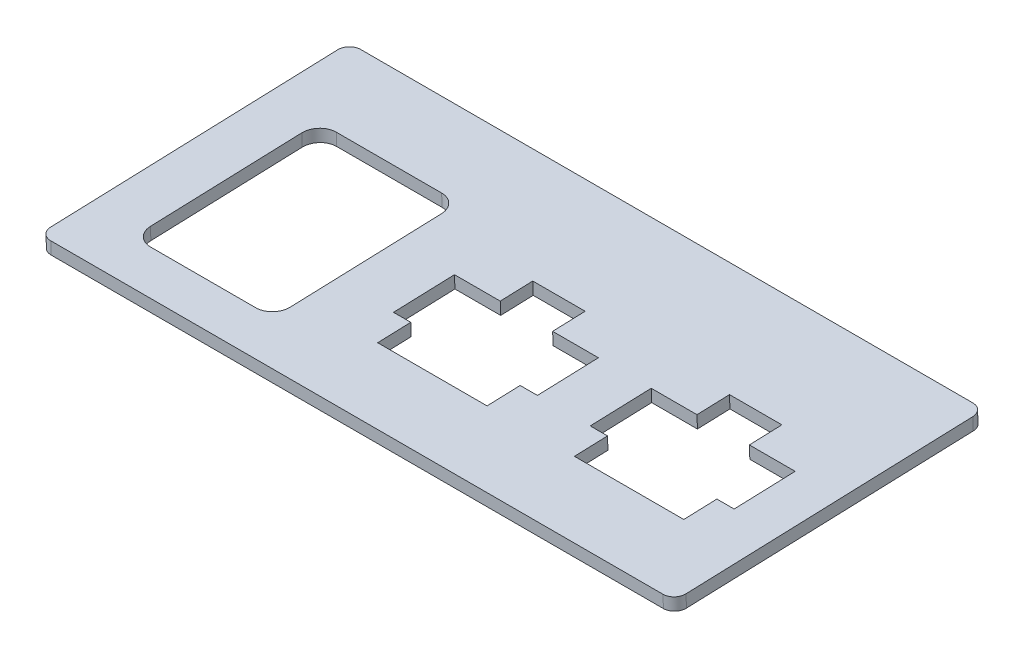
from build123d import *

# Parameters (mm, degrees)
SKETCH1_W           = 110.35
SKETCH1_H           = 53.851961072
BOSS_EXTRUDE1_DEPTH = 2.2
CUT_EXTRUDE1_REACH  = 76.303
FILLET1_R           = 2


with BuildPart() as part:
    # Sketch1 → Boss-Extrude1 (new body)
    with BuildSketch(Plane(origin=(0, -71.98718802, -2.513847999), x_dir=(1, 0, 0), z_dir=(0, 0.9993908270190958, 0.03489949670250105))):
        with Locations((0, 22.714385256)):
            Rectangle(SKETCH1_W, SKETCH1_H)
    extrude(amount=BOSS_EXTRUDE1_DEPTH)

    # Sketch2 → Cut-Extrude1 (cut, up to next)
    with BuildSketch(Plane(origin=(0, -71.98718802, -2.513847999), x_dir=(1, 0, 0), z_dir=(0, -0.9993908270190958, -0.03489949670250106)), mode=Mode.PRIVATE) as cut_extrude1_sk1:
        Polygon((-4.05, -24.762401314), (-4.05, -30.412401314), (5.05, -30.412401314), (5.05, -24.762401314), (13, -24.762401314), (13, -14.162401314), (10, -14.162401314), (10, -8.412401314), (-9, -8.412401314), (-9, -14.162401314), (-12, -14.162401314), (-12, -24.762401314), align=None)
    cut_extrude1_tool1 = extrude(cut_extrude1_sk1.sketch, amount=-CUT_EXTRUDE1_REACH, mode=Mode.PRIVATE) & part.part
    # Sketch2 → Cut-Extrude1 (cut, up to next)
    with BuildSketch(Plane(origin=(0, -71.98718802, -2.513847999), x_dir=(1, 0, 0), z_dir=(0, -0.9993908270190958, -0.03489949670250106)), mode=Mode.PRIVATE) as cut_extrude1_sk2:
        with BuildLine():
            Line((-43.325, -3.262401314), (-25.025, -3.262401314))
            ThreePointArc((-25.025, -3.262401314), (-22.903679656, -4.14108097), (-22.025, -6.262401314))
            Line((-22.025, -6.262401314), (-22.025, -32.562401314))
            ThreePointArc((-22.025, -32.562401314), (-22.903679656, -34.683721657), (-25.025, -35.562401314))
            Line((-25.025, -35.562401314), (-43.325, -35.562401314))
            ThreePointArc((-43.325, -35.562401314), (-45.446320344, -34.683721657), (-46.325, -32.562401314))
            Line((-46.325, -32.562401314), (-46.325, -6.262401314))
            ThreePointArc((-46.325, -6.262401314), (-45.446320344, -4.14108097), (-43.325, -3.262401314))
        make_face()
    cut_extrude1_tool2 = extrude(cut_extrude1_sk2.sketch, amount=-CUT_EXTRUDE1_REACH, mode=Mode.PRIVATE) & part.part
    # Sketch2 → Cut-Extrude1 (cut, up to next)
    with BuildSketch(Plane(origin=(0, -71.98718802, -2.513847999), x_dir=(1, 0, 0), z_dir=(0, -0.9993908270190958, -0.03489949670250106)), mode=Mode.PRIVATE) as cut_extrude1_sk3:
        Polygon((30.125, -24.762401314), (22.175, -24.762401314), (22.175, -14.162401314), (25.175, -14.162401314), (25.175, -8.412401314), (44.175, -8.412401314), (44.175, -14.162401314), (47.175, -14.162401314), (47.175, -24.762401314), (39.225, -24.762401314), (39.225, -30.412401314), (30.125, -30.412401314), align=None)
    cut_extrude1_tool3 = extrude(cut_extrude1_sk3.sketch, amount=-CUT_EXTRUDE1_REACH, mode=Mode.PRIVATE) & part.part
    add(cut_extrude1_tool1.solids().sort_by_distance((0.5, -71.346935, -20.848299))[0], mode=Mode.SUBTRACT)
    add(cut_extrude1_tool2.solids().sort_by_distance((-34.175, -71.309705, -21.914424))[0], mode=Mode.SUBTRACT)
    add(cut_extrude1_tool3.solids().sort_by_distance((34.675, -71.346935, -20.848299))[0], mode=Mode.SUBTRACT)

    # Fillet1
    fillet1_edges = [part.edges().sort_by_distance(p)[0] for p in [
        (-55.175, -71.034840666, 1.733571137),
        (55.175, -71.034840666, 1.733571137),
        (55.175, -69.155434328, -52.085584775),
        (-55.175, -69.155434328, -52.085584775),
    ]]
    fillet(fillet1_edges, radius=FILLET1_R)


solid = part.part
